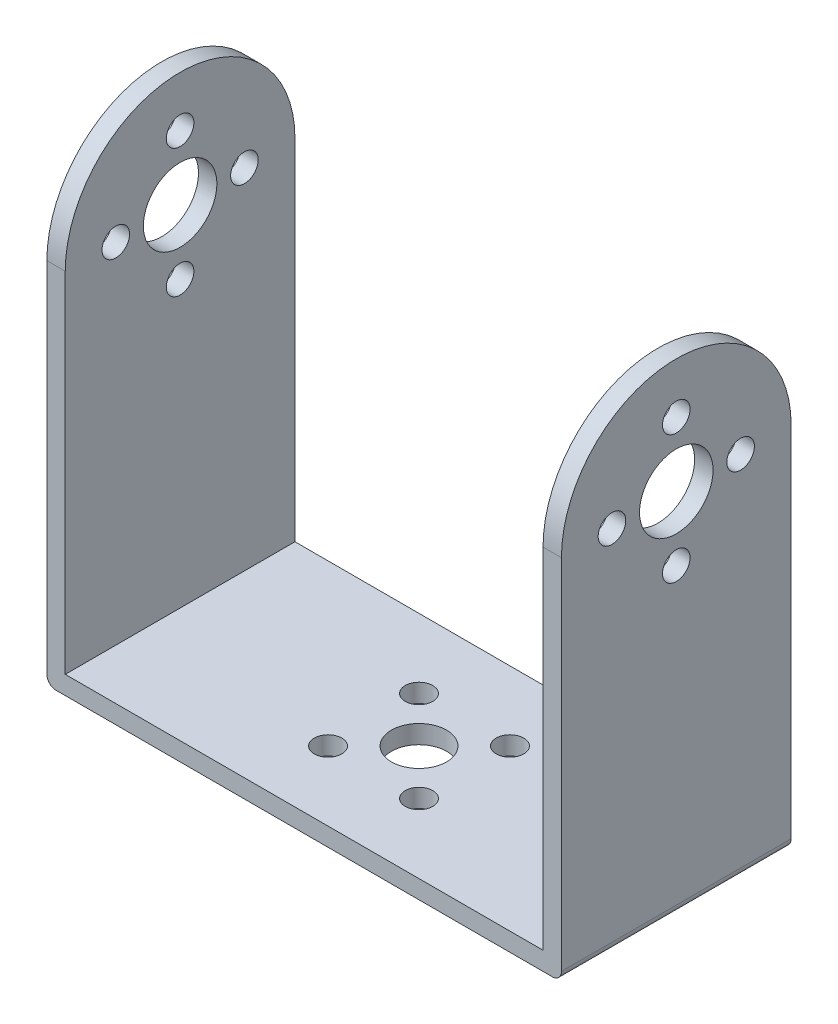
from build123d import *

# Parameters (mm, degrees)
SKETCH_1_W          = 56
SKETCH_1_H          = 25
EXTRUDE_1_DEPTH     = 2
SKETCH_2_R          = 3
SKETCH_2_R_2        = 1.5
CUT_EXTRUDE_1_DEPTH = 39.082744359
EXTRUDE_2_DEPTH     = 2
CUT_EXTRUDE_2_REACH = 79.893
SKETCH_4_R          = 4
SKETCH_4_R_2        = 1.5
FILLET_1_R          = 1


with BuildPart() as part:
    # 草图1 → 凸台-拉伸1 (new body)
    with BuildSketch(Plane(origin=(0, 0, 0), x_dir=(1, 0, 0), z_dir=(0, 1, 0))):
        with Locations((7.654255319, 0.731382979)):
            Rectangle(SKETCH_1_W, SKETCH_1_H)
    extrude(amount=EXTRUDE_1_DEPTH)

    # 草图2 → 切除-拉伸1 (cut, through all)
    with BuildSketch(Plane(origin=(0, 2, 0), x_dir=(1, 0, 0), z_dir=(0, 1, 0))):
        with Locations((7.654255319, 0.731382979)):
            Circle(SKETCH_2_R)
        with Locations((12.604002787, 5.681130447)):
            Circle(SKETCH_2_R_2)
        with Locations((2.704507851, 5.681130447)):
            Circle(SKETCH_2_R_2)
        with Locations((12.604002787, -4.21836449)):
            Circle(SKETCH_2_R_2)
        with Locations((2.704507851, -4.21836449)):
            Circle(SKETCH_2_R_2)
    extrude(amount=-CUT_EXTRUDE_1_DEPTH, mode=Mode.SUBTRACT)

    # 草图3 → 凸台-拉伸2 (add)
    with BuildSketch(Plane.ZY.offset(20.345744681)):
        with BuildLine():
            Line((-13.231382979, 40), (-13.231382979, 2))
            Line((-13.231382979, 2), (11.768617021, 2))
            Line((11.768617021, 2), (11.768617021, 40))
            ThreePointArc((11.768617021, 40), (-0.731382979, 52.5), (-13.231382979, 40))
        make_face()
    extrude_2 = extrude(amount=-EXTRUDE_2_DEPTH)

    # 草图4 → 切除-拉伸2 (cut, up to next)
    with BuildSketch(Plane.ZY.offset(20.345744681), mode=Mode.PRIVATE) as cut_extrude_2_sk1:
        with Locations((-0.731382979, 40)):
            Circle(SKETCH_4_R)
    cut_extrude_2_tool1 = extrude(cut_extrude_2_sk1.sketch, amount=-CUT_EXTRUDE_2_REACH, mode=Mode.PRIVATE) & part.part
    # 草图4 → 切除-拉伸2 (cut, up to next)
    with BuildSketch(Plane.ZY.offset(20.345744681), mode=Mode.PRIVATE) as cut_extrude_2_sk2:
        with Locations((-0.731382979, 47)):
            Circle(SKETCH_4_R_2)
    cut_extrude_2_tool2 = extrude(cut_extrude_2_sk2.sketch, amount=-CUT_EXTRUDE_2_REACH, mode=Mode.PRIVATE) & part.part
    # 草图4 → 切除-拉伸2 (cut, up to next)
    with BuildSketch(Plane.ZY.offset(20.345744681), mode=Mode.PRIVATE) as cut_extrude_2_sk3:
        with Locations((6.268617021, 40)):
            Circle(SKETCH_4_R_2)
    cut_extrude_2_tool3 = extrude(cut_extrude_2_sk3.sketch, amount=-CUT_EXTRUDE_2_REACH, mode=Mode.PRIVATE) & part.part
    # 草图4 → 切除-拉伸2 (cut, up to next)
    with BuildSketch(Plane.ZY.offset(20.345744681), mode=Mode.PRIVATE) as cut_extrude_2_sk4:
        with Locations((-0.731382979, 33)):
            Circle(SKETCH_4_R_2)
    cut_extrude_2_tool4 = extrude(cut_extrude_2_sk4.sketch, amount=-CUT_EXTRUDE_2_REACH, mode=Mode.PRIVATE) & part.part
    # 草图4 → 切除-拉伸2 (cut, up to next)
    with BuildSketch(Plane.ZY.offset(20.345744681), mode=Mode.PRIVATE) as cut_extrude_2_sk5:
        with Locations((-7.731382979, 40)):
            Circle(SKETCH_4_R_2)
    cut_extrude_2_tool5 = extrude(cut_extrude_2_sk5.sketch, amount=-CUT_EXTRUDE_2_REACH, mode=Mode.PRIVATE) & part.part
    cut_extrude_2_1 = cut_extrude_2_tool1.solids().sort_by_distance((-20.345745, 40, -0.731383))[0]
    add(cut_extrude_2_1, mode=Mode.SUBTRACT)
    cut_extrude_2_2 = cut_extrude_2_tool2.solids().sort_by_distance((-20.345745, 47, -0.731383))[0]
    add(cut_extrude_2_2, mode=Mode.SUBTRACT)
    cut_extrude_2_3 = cut_extrude_2_tool3.solids().sort_by_distance((-20.345745, 40, 6.268617))[0]
    add(cut_extrude_2_3, mode=Mode.SUBTRACT)
    cut_extrude_2_4 = cut_extrude_2_tool4.solids().sort_by_distance((-20.345745, 33, -0.731383))[0]
    add(cut_extrude_2_4, mode=Mode.SUBTRACT)
    cut_extrude_2_5 = cut_extrude_2_tool5.solids().sort_by_distance((-20.345745, 40, -7.731383))[0]
    add(cut_extrude_2_5, mode=Mode.SUBTRACT)
    cut_extrude_2 = cut_extrude_2_1 + cut_extrude_2_2 + cut_extrude_2_3 + cut_extrude_2_4 + cut_extrude_2_5  # 切除-拉伸2 as one shape, for the pattern or mirror that repeats it

    # 镜向1: 凸台-拉伸2, 切除-拉伸2 across plane
    add(extrude_2.mirror(Plane.ZY.offset(-7.654255319)))
    add(cut_extrude_2.mirror(Plane.ZY.offset(-7.654255319)), mode=Mode.SUBTRACT)

    # 圆角1
    fillet_1_edges = [part.edges().sort_by_distance(p)[0] for p in [
        (35.654255319, 0, -0.731382979),
        (-20.345744681, 0, -0.731382979),
    ]]
    fillet(fillet_1_edges, radius=FILLET_1_R)


solid = part.part
